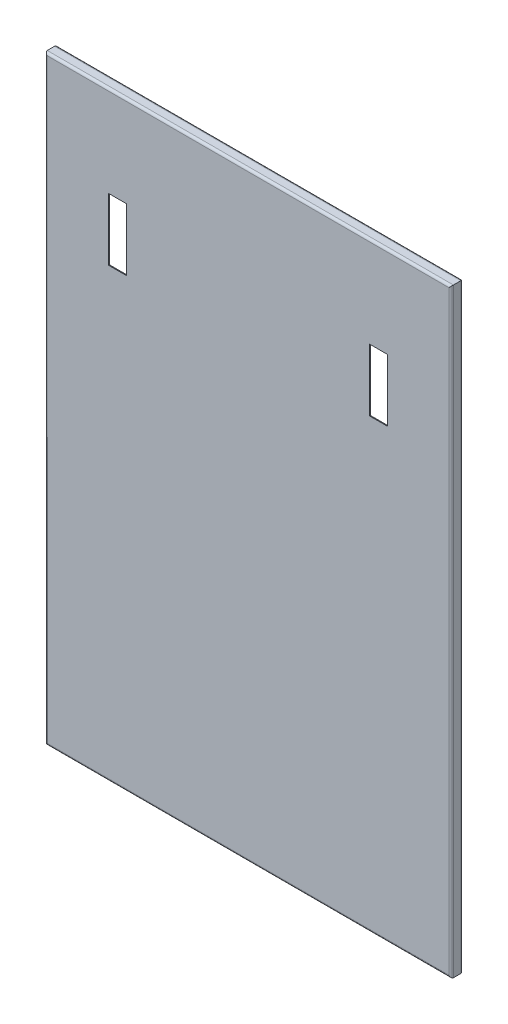
from build123d import *

# Parameters (mm, degrees)
SKETCH_1_W          = 568
SKETCH_1_H          = 839
EXTRUDE_1_DEPTH     = 1.2
SKETCH_2_W          = 25
SKETCH_2_H          = 87
CUT_EXTRUDE_1_DEPTH = 1014.186280997
SKETCH_3_W          = 568
SKETCH_3_H          = 839
SKETCH_3_W_2        = 565.6
SKETCH_3_H_2        = 836.6
EXTRUDE_2_DEPTH     = 15.5
SKETCH_4_W          = 568
SKETCH_4_H          = 839
SKETCH_4_W_2        = 538
SKETCH_4_H_2        = 809
EXTRUDE_3_DEPTH     = 1.2
FILLET_1_R          = 3.2
FILLET_3_R          = 2
FILLET_4_R          = 3.2
FILLET_5_R          = 2
FILLET_6_R          = 2


with BuildPart() as part:
    # 스케치1 → 보스-돌출1 (new body)
    with BuildSketch(Plane.XY):
        with Locations((284, 419.5)):
            Rectangle(SKETCH_1_W, SKETCH_1_H)
    extrude(amount=EXTRUDE_1_DEPTH)

    # 스케치2 → 컷-돌출1 (cut, through all)
    with BuildSketch(Plane.XY.offset(1.2)):
        with Locations((101.5, 668.5)):
            Rectangle(SKETCH_2_W, SKETCH_2_H)
        with Locations((466.5, 668.5)):
            Rectangle(SKETCH_2_W, SKETCH_2_H)
    extrude(amount=-CUT_EXTRUDE_1_DEPTH, mode=Mode.SUBTRACT)

    # 스케치3 → 보스-돌출2 (add)
    with BuildSketch(Plane(origin=(0, 0, 0), x_dir=(-1, 0, 0), z_dir=(0, 0, -1))):
        with Locations((-284, 419.5)):
            Rectangle(SKETCH_3_W, SKETCH_3_H)
        with Locations((-284, 419.5)):
            Rectangle(SKETCH_3_W_2, SKETCH_3_H_2, mode=Mode.SUBTRACT)
    extrude(amount=EXTRUDE_2_DEPTH)

    # 스케치4 → 보스-돌출3 (add)
    with BuildSketch(Plane(origin=(0, 0, -15.5), x_dir=(-1, 0, 0), z_dir=(0, 0, -1))):
        with Locations((-284, 419.5)):
            Rectangle(SKETCH_4_W, SKETCH_4_H)
        with Locations((-284, 419.5)):
            Rectangle(SKETCH_4_W_2, SKETCH_4_H_2, mode=Mode.SUBTRACT)
    extrude(amount=-EXTRUDE_3_DEPTH)

    # 필렛1
    fillet_1_edges = [part.edges().sort_by_distance(p)[0] for p in [
        (568, 419.5, 1.2),
        (284, 839, 1.2),
        (0, 419.5, 1.2),
        (284, 0, 1.2),
    ]]
    fillet(fillet_1_edges, radius=FILLET_1_R)

    # 필렛3
    fillet_3_edges = [part.edges().sort_by_distance(p)[0] for p in [
        (1.2, 419.5, 0),
        (284, 837.8, 0),
        (566.8, 419.5, 0),
        (284, 1.2, 0),
    ]]
    fillet(fillet_3_edges, radius=FILLET_3_R)

    # 필렛4
    fillet_4_edges = [part.edges().sort_by_distance(p)[0] for p in [
        (284, 0, -15.5),
        (0, 419.5, -15.5),
        (284, 839, -15.5),
        (568, 419.5, -15.5),
    ]]
    fillet(fillet_4_edges, radius=FILLET_4_R)

    # 필렛5
    fillet_5_edges = [part.edges().sort_by_distance(p)[0] for p in [
        (284, 1.2, -14.3),
        (284, 837.8, -14.3),
    ]]
    fillet(fillet_5_edges, radius=FILLET_5_R)

    # 필렛6
    # the kernel refuses this fillet: 2 mm, written as the material it adds along each edge
    with BuildSketch(Plane(origin=(564.8, 835.8, -2), x_dir=(0, 1, 0), z_dir=(1, 0, 0))) as fillet_6_piece_1_section:
        Polygon((0, 0), (FILLET_6_R, 0), (FILLET_6_R, FILLET_6_R), (0, FILLET_6_R), align=None)
    fillet_6_piece_1 = extrude(amount=FILLET_6_R, mode=Mode.PRIVATE)
    fillet_6_piece_1 = fillet_6_piece_1 - Plane(origin=(564.8, 835.8, -2), x_dir=(0, -0.7071067811865475, -0.7071067811865475), z_dir=(1, 0, 0)) * Sphere(FILLET_6_R, mode=Mode.PRIVATE)
    add(fillet_6_piece_1)
    with BuildSketch(Plane(origin=(3.2, 835.8, -2), x_dir=(0, 1, 0), z_dir=(-1, 0, 0))) as fillet_6_piece_2_section:
        Polygon((0, 0), (FILLET_6_R, 0), (FILLET_6_R, -FILLET_6_R), (0, -FILLET_6_R), align=None)
    fillet_6_piece_2 = extrude(amount=FILLET_6_R, mode=Mode.PRIVATE)
    fillet_6_piece_2 = fillet_6_piece_2 - Plane(origin=(3.2, 835.8, -2), x_dir=(0, -0.7071067811865475, -0.7071067811865475), z_dir=(-1, 0, 0)) * Sphere(FILLET_6_R, mode=Mode.PRIVATE)
    add(fillet_6_piece_2)
    with BuildSketch(Plane(origin=(564.8, 3.2, -2), x_dir=(0, -1, 0), z_dir=(1, 0, 0))) as fillet_6_piece_3_section:
        Polygon((0, 0), (FILLET_6_R, 0), (FILLET_6_R, -FILLET_6_R), (0, -FILLET_6_R), align=None)
    fillet_6_piece_3 = extrude(amount=FILLET_6_R, mode=Mode.PRIVATE)
    fillet_6_piece_3 = fillet_6_piece_3 - Plane(origin=(564.8, 3.2, -2), x_dir=(0, 0.7071067811865475, -0.7071067811865475), z_dir=(1, 0, 0)) * Sphere(FILLET_6_R, mode=Mode.PRIVATE)
    add(fillet_6_piece_3)
    with BuildSketch(Plane(origin=(3.2, 3.2, -2), x_dir=(0, -1, 0), z_dir=(-1, 0, 0))) as fillet_6_piece_4_section:
        Polygon((0, 0), (FILLET_6_R, 0), (FILLET_6_R, FILLET_6_R), (0, FILLET_6_R), align=None)
    fillet_6_piece_4 = extrude(amount=FILLET_6_R, mode=Mode.PRIVATE)
    fillet_6_piece_4 = fillet_6_piece_4 - Plane(origin=(3.2, 3.2, -2), x_dir=(0, 0.7071067811865475, -0.7071067811865475), z_dir=(-1, 0, 0)) * Sphere(FILLET_6_R, mode=Mode.PRIVATE)
    add(fillet_6_piece_4)
    with BuildSketch(Plane(origin=(566.8, 837.8, -2), x_dir=(0, -1, 0), z_dir=(0, 0, -1)), Plane(origin=(1.2, 1.2, -2), x_dir=(0, 1, 0), z_dir=(0, 0, -1))) as fillet_6_piece_5:
        with BuildLine():
            CenterArc((FILLET_6_R, FILLET_6_R), FILLET_6_R, 180, 90)
            Line((0, FILLET_6_R), (0, 0))
            Line((0, 0), (FILLET_6_R, 0))
        make_face()
    extrude(amount=10.3)
    with BuildSketch(Plane(origin=(1.2, 837.8, -2), x_dir=(0, -1, 0), z_dir=(0, 0, -1)), Plane(origin=(566.8, 1.2, -2), x_dir=(0, 1, 0), z_dir=(0, 0, -1))) as fillet_6_piece_6:
        with BuildLine():
            CenterArc((FILLET_6_R, -FILLET_6_R), FILLET_6_R, 90, 90)
            Line((0, -FILLET_6_R), (0, 0))
            Line((0, 0), (FILLET_6_R, 0))
        make_face()
    extrude(amount=10.3)
    with BuildSketch(Plane(origin=(566.8, 835.8, -14.3), x_dir=(-1, 0, 0), z_dir=(0, -1, 0)), Plane(origin=(1.2, 3.2, -14.3), x_dir=(1, 0, 0), z_dir=(0, 1, 0))) as fillet_6_piece_7:
        with BuildLine():
            CenterArc((FILLET_6_R, -FILLET_6_R), FILLET_6_R, 90, 90)
            Line((0, -FILLET_6_R), (0, 0))
            Line((0, 0), (FILLET_6_R, 0))
        make_face()
    extrude(amount=832.6)
    with BuildSketch(Plane(origin=(566.8, 3.2, -12.3), x_dir=(0, 0, -1), z_dir=(0, 1, 0))) as fillet_6_piece_8:
        with BuildLine():
            CenterArc((2 - FILLET_6_R, FILLET_6_R), FILLET_6_R, 270, 90)
            Line((2 - FILLET_6_R, 0), (2, 0))
            Line((2, 0), (2, FILLET_6_R))
        make_face()
    revolve(axis=Axis((566.8, 3.2, -12.3), (-1, 0, 0)), revolution_arc=90)
    with BuildSketch(Plane(origin=(566.8, 835.8, -12.3), x_dir=(0, 0, -1), z_dir=(0, -1, 0))) as fillet_6_piece_9:
        with BuildLine():
            CenterArc((2 - FILLET_6_R, -FILLET_6_R), FILLET_6_R, 0, 90)
            Line((2 - FILLET_6_R, 0), (2, 0))
            Line((2, 0), (2, -FILLET_6_R))
        make_face()
    revolve(axis=Axis((566.8, 835.8, -12.3), (1, 0, 0)), revolution_arc=90)
    with BuildSketch(Plane(origin=(1.2, 3.2, -12.3), x_dir=(0, 0, -1), z_dir=(0, 1, 0))) as fillet_6_piece_10:
        with BuildLine():
            CenterArc((2 - FILLET_6_R, -FILLET_6_R), FILLET_6_R, 360, 90)
            Line((2, -FILLET_6_R), (2, 0))
            Line((2, 0), (2 - FILLET_6_R, 0))
        make_face()
    revolve(axis=Axis((1.2, 3.2, -12.3), (-1, 0, 0)), revolution_arc=90)
    with BuildSketch(Plane(origin=(1.2, 835.8, -12.3), x_dir=(0, 0, -1), z_dir=(0, -1, 0))) as fillet_6_piece_11:
        with BuildLine():
            CenterArc((2 - FILLET_6_R, FILLET_6_R), FILLET_6_R, 270, 90)
            Line((2, FILLET_6_R), (2, 0))
            Line((2, 0), (2 - FILLET_6_R, 0))
        make_face()
    revolve(axis=Axis((1.2, 835.8, -12.3), (1, 0, 0)), revolution_arc=90)


solid = part.part
